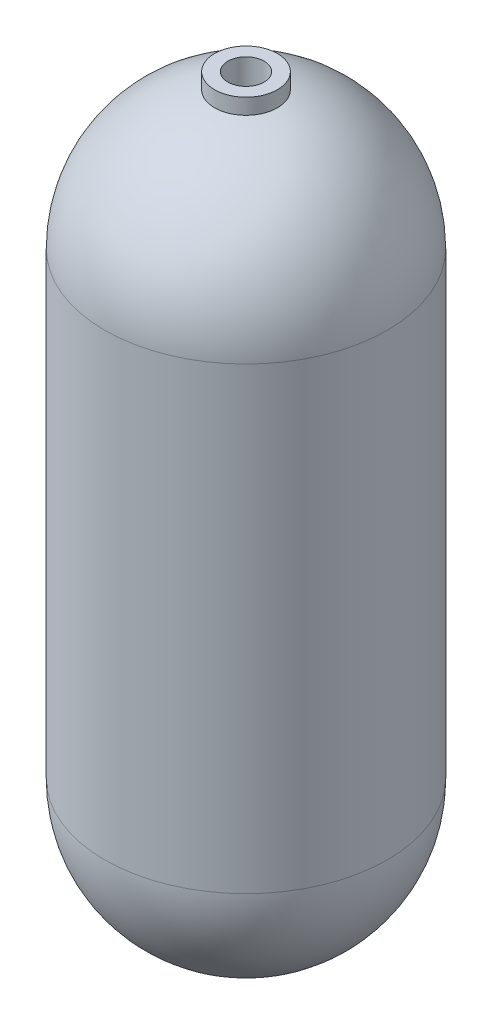
from build123d import *

# Parameters (mm, degrees)
F_5_8_18_TAPPED_HOLE2_D     = 14.68374
F_5_8_18_TAPPED_HOLE2_DEPTH = 38.862
F_5_8_18_TAPPED_HOLE2_TIP   = 4.411440553


with BuildPart() as part:
    # Sketch4 → Revolve1 (revolve)
    with BuildSketch(Plane.XY):
        with BuildLine():
            Line((12.7, 62.07102386), (12.7, 55.72102386))
            ThreePointArc((12.7, 55.72102386), (44.676210112, 35.639286609), (57.15, 0))
            Line((57.15, 0), (57.15, -185.57897614))
            ThreePointArc((57.15, -185.57897614), (40.411152545, -225.990128685), (0, -242.72897614))
            Line((0, -242.72897614), (0, -236.37897614))
            ThreePointArc((0, -236.37897614), (35.921024484, -221.500000624), (50.8, -185.57897614))
            Line((50.8, -185.57897614), (50.8, 0))
            ThreePointArc((50.8, 0), (38.1, 33.601041651), (6.35, 50.401562476))
            ThreePointArc((6.35, 50.401562476), (4.44815289, 50.604880554), (2.54, 50.736460263))
            Line((2.54, 50.736460263), (2.54, 62.07102386))
            Line((2.54, 62.07102386), (6.35, 62.07102386))
            Line((6.35, 62.07102386), (12.7, 62.07102386))
        make_face()
    revolve(axis=Axis((0, 80.447885323, 0), (0, -1, 0)))

    # 5/8-18 Tapped Hole2
    with Locations(Plane(origin=(0, 62.07102386, 0), x_dir=(1, 0, 0), z_dir=(0, 1, 0))):
        with Locations((0, 0)):
            Hole(F_5_8_18_TAPPED_HOLE2_D / 2, depth=F_5_8_18_TAPPED_HOLE2_DEPTH)
            with Locations((0, 0, -(F_5_8_18_TAPPED_HOLE2_DEPTH + F_5_8_18_TAPPED_HOLE2_TIP / 2))):  # 118° drill point
                Cone(0, F_5_8_18_TAPPED_HOLE2_D / 2, F_5_8_18_TAPPED_HOLE2_TIP, mode=Mode.SUBTRACT)


solid = part.part
